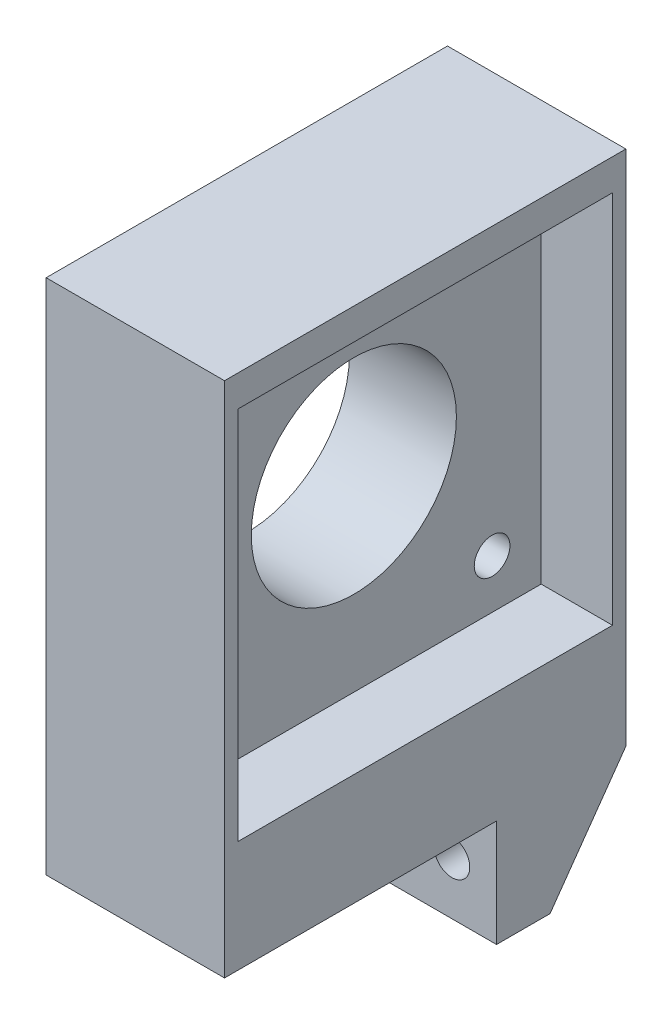
from build123d import *

# Parameters (mm, degrees)
SKETCH1_W           = 20
SKETCH1_H           = 45
BOSS_EXTRUDE1_DEPTH = 70
SKETCH2_R           = 2
SKETCH2_R_2         = 11.5
CUT_EXTRUDE2_DEPTH  = 60
SKETCH4_W           = 30.5
SKETCH4_H           = 12
CUT_EXTRUDE3_DEPTH  = 60
SKETCH8_R           = 2
CUT_EXTRUDE5_DEPTH  = 15
SKETCH9_W           = 42
SKETCH9_H           = 42
CUT_EXTRUDE6_DEPTH  = 8
CUT_EXTRUDE8_DEPTH  = 30
SKETCH17_R          = 3.5
CUT_EXTRUDE13_DEPTH = 9.18109305


with BuildPart() as part:
    # Sketch1 → Boss-Extrude1 (new body)
    with BuildSketch(Plane(origin=(0, 0, 0), x_dir=(1, 0, 0), z_dir=(0, 1, 0))):
        with Locations((-10, -22.5)):
            Rectangle(SKETCH1_W, SKETCH1_H)
    extrude(amount=BOSS_EXTRUDE1_DEPTH)

    # Sketch2 → Cut-Extrude2 (cut)
    with BuildSketch(Plane(origin=(0, 0, 0), x_dir=(0, 0, -1), z_dir=(1, 0, 0))):
        with Locations((-7, 61)):
            Circle(SKETCH2_R)
        with Locations((-22.5, 45.5)):
            Circle(SKETCH2_R_2)
        with Locations((-7, 30)):
            Circle(SKETCH2_R)
        with Locations((-38, 30)):
            Circle(SKETCH2_R)
        with Locations((-38, 61)):
            Circle(SKETCH2_R)
    extrude(amount=-CUT_EXTRUDE2_DEPTH, mode=Mode.SUBTRACT)

    # Sketch4 → Cut-Extrude3 (cut)
    with BuildSketch(Plane(origin=(0, 0, 0), x_dir=(0, 0, -1), z_dir=(1, 0, 0))):
        with Locations((-29.75, 6)):
            Rectangle(SKETCH4_W, SKETCH4_H)
    extrude(amount=-CUT_EXTRUDE3_DEPTH, mode=Mode.SUBTRACT)

    # Sketch8 → Cut-Extrude5 (cut)
    with BuildSketch(Plane(origin=(0, 0, 0), x_dir=(-1, 0, 0), z_dir=(0, 0, -1))):
        with Locations((15, 6)):
            Circle(SKETCH8_R)
        with Locations((5, 6)):
            Circle(SKETCH8_R)
    extrude(amount=-CUT_EXTRUDE5_DEPTH, mode=Mode.SUBTRACT)

    # Sketch9 → Cut-Extrude6 (cut)
    with BuildSketch(Plane(origin=(0, 0, 0), x_dir=(0, 0, -1), z_dir=(1, 0, 0))):
        with Locations((-22.5, 45.5)):
            Rectangle(SKETCH9_W, SKETCH9_H)
    extrude(amount=-CUT_EXTRUDE6_DEPTH, mode=Mode.SUBTRACT)

    # Sketch11 → Cut-Extrude8 (cut)
    with BuildSketch(Plane(origin=(0, 0, 0), x_dir=(0, 0, -1), z_dir=(1, 0, 0))):
        Polygon((-8.5, 0), (0, 0), (0, 12), align=None)
    extrude(amount=-CUT_EXTRUDE8_DEPTH, mode=Mode.SUBTRACT)

    # Sketch17 → Cut-Extrude13 (cut)
    with BuildSketch(Plane(origin=(0, 0, 0), x_dir=(-1, 0, 0), z_dir=(0, 0, -1))):
        with Locations((15, 6)):
            Circle(SKETCH17_R)
        with Locations((5, 6)):
            Circle(SKETCH17_R)
    extrude(amount=-CUT_EXTRUDE13_DEPTH, mode=Mode.SUBTRACT)


solid = part.part
